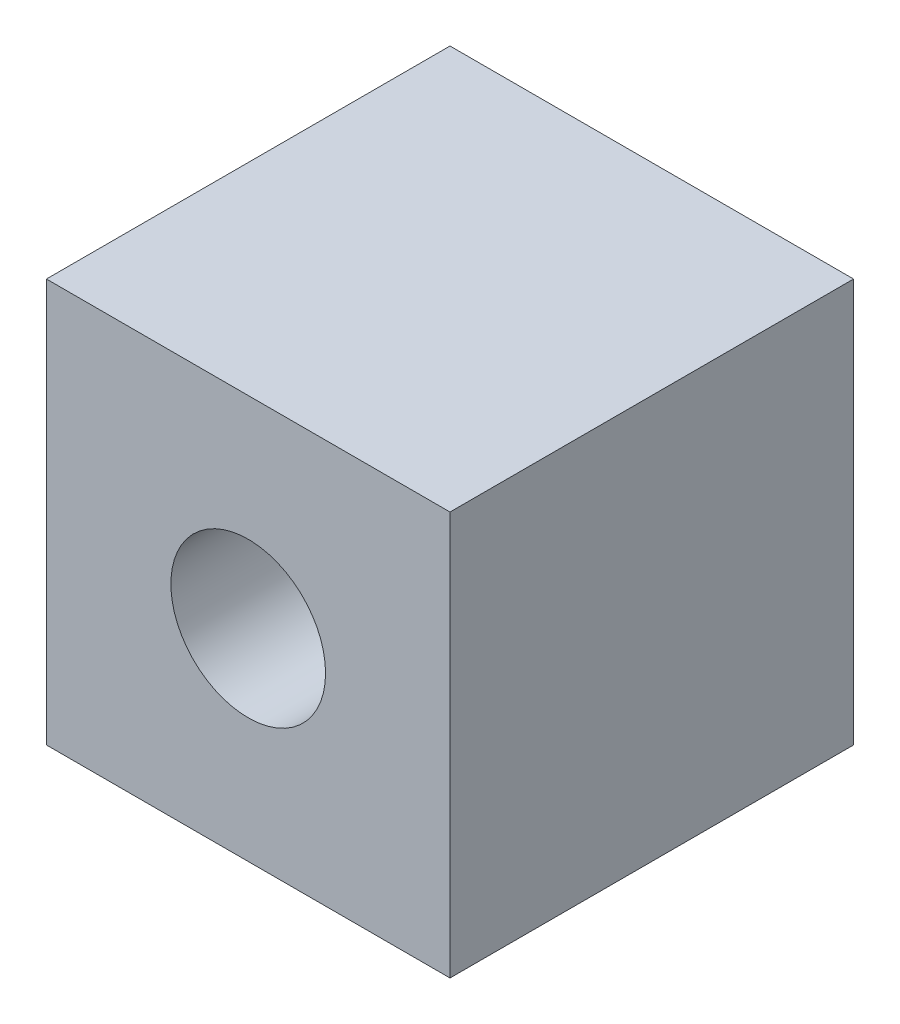
from build123d import *

# Parameters (mm, degrees)
SKETCH_1_W          = 6
SKETCH_1_H          = 6
EXTRUDE_1_DEPTH     = 6
SKETCH_2_R          = 1.15
CUT_EXTRUDE_1_DEPTH = 8.485265724


with BuildPart() as part:
    # ｽｹｯﾁ1 → ﾎﾞｽ - 押し出し1 (new body)
    with BuildSketch(Plane.XY):
        with Locations((0.221154353, -0.1069869)):
            Rectangle(SKETCH_1_W, SKETCH_1_H)
    extrude(amount=EXTRUDE_1_DEPTH)

    # ｽｹｯﾁ2 → ｶｯﾄ - 押し出し1 (cut, through all)
    with BuildSketch(Plane.XY.offset(6)):
        with Locations((0.221154353, -0.1069869)):
            Circle(SKETCH_2_R)
    extrude(amount=-CUT_EXTRUDE_1_DEPTH, mode=Mode.SUBTRACT)


solid = part.part
